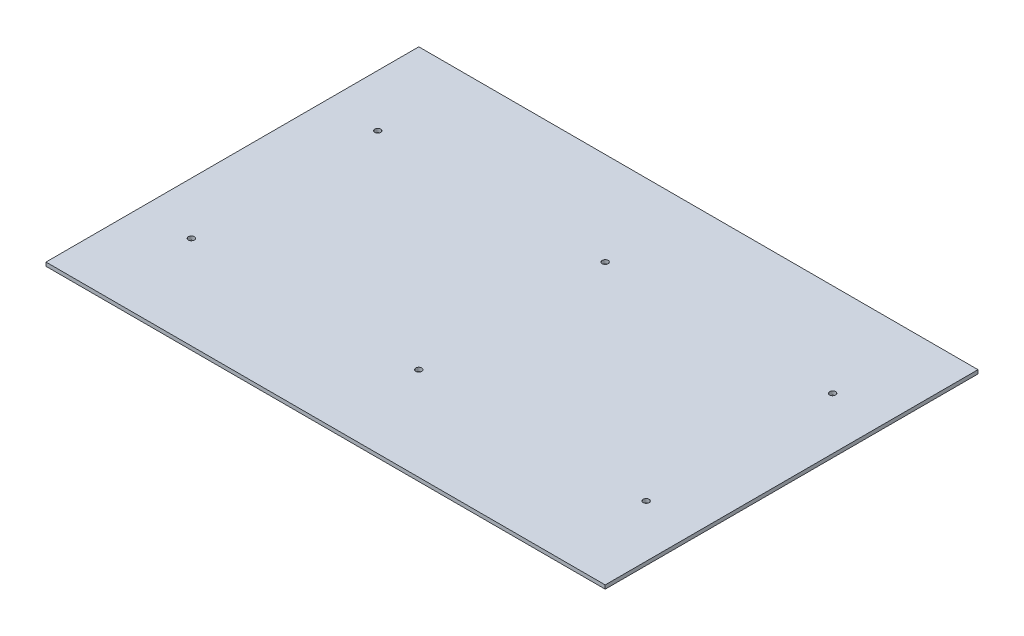
from build123d import *

# Parameters (mm, degrees)
SKETCH1_W           = 750
SKETCH1_H           = 500
BOSS_EXTRUDE1_DEPTH = 5
SKETCH2_R           = 4
CUT_EXTRUDE1_DEPTH  = 10
SKETCH3_R           = 4
CUT_EXTRUDE2_DEPTH  = 10
SKETCH4_R           = 4
CUT_EXTRUDE3_DEPTH  = 10
SKETCH5_R           = 4
CUT_EXTRUDE4_DEPTH  = 10
SKETCH6_R           = 4
CUT_EXTRUDE5_DEPTH  = 10
SKETCH7_R           = 4
CUT_EXTRUDE6_DEPTH  = 10


with BuildPart() as part:
    # Sketch1 → Boss-Extrude1 (new body)
    with BuildSketch(Plane(origin=(0, 0, 0), x_dir=(1, 0, 0), z_dir=(0, 1, 0))):
        Rectangle(SKETCH1_W, SKETCH1_H)
    extrude(amount=BOSS_EXTRUDE1_DEPTH)

    # Sketch2 → Cut-Extrude1 (cut)
    with BuildSketch(Plane(origin=(0, 5, 0), x_dir=(1, 0, 0), z_dir=(0, 1, 0))):
        with Locations((305, 125)):
            Circle(SKETCH2_R)
    extrude(amount=-CUT_EXTRUDE1_DEPTH, mode=Mode.SUBTRACT)

    # Sketch3 → Cut-Extrude2 (cut)
    with BuildSketch(Plane(origin=(0, 5, 0), x_dir=(1, 0, 0), z_dir=(0, 1, 0))):
        with Locations((305, -125)):
            Circle(SKETCH3_R)
    extrude(amount=-CUT_EXTRUDE2_DEPTH, mode=Mode.SUBTRACT)

    # Sketch4 → Cut-Extrude3 (cut)
    with BuildSketch(Plane(origin=(0, 5, 0), x_dir=(1, 0, 0), z_dir=(0, 1, 0))):
        with Locations((0, 125)):
            Circle(SKETCH4_R)
    extrude(amount=-CUT_EXTRUDE3_DEPTH, mode=Mode.SUBTRACT)

    # Sketch5 → Cut-Extrude4 (cut)
    with BuildSketch(Plane(origin=(0, 5, 0), x_dir=(1, 0, 0), z_dir=(0, 1, 0))):
        with Locations((0, -125)):
            Circle(SKETCH5_R)
    extrude(amount=-CUT_EXTRUDE4_DEPTH, mode=Mode.SUBTRACT)

    # Sketch6 → Cut-Extrude5 (cut)
    with BuildSketch(Plane(origin=(0, 5, 0), x_dir=(1, 0, 0), z_dir=(0, 1, 0))):
        with Locations((-305, 125)):
            Circle(SKETCH6_R)
    extrude(amount=-CUT_EXTRUDE5_DEPTH, mode=Mode.SUBTRACT)

    # Sketch7 → Cut-Extrude6 (cut)
    with BuildSketch(Plane(origin=(0, 5, 0), x_dir=(1, 0, 0), z_dir=(0, 1, 0))):
        with Locations((-305, -125)):
            Circle(SKETCH7_R)
    extrude(amount=-CUT_EXTRUDE6_DEPTH, mode=Mode.SUBTRACT)


solid = part.part
